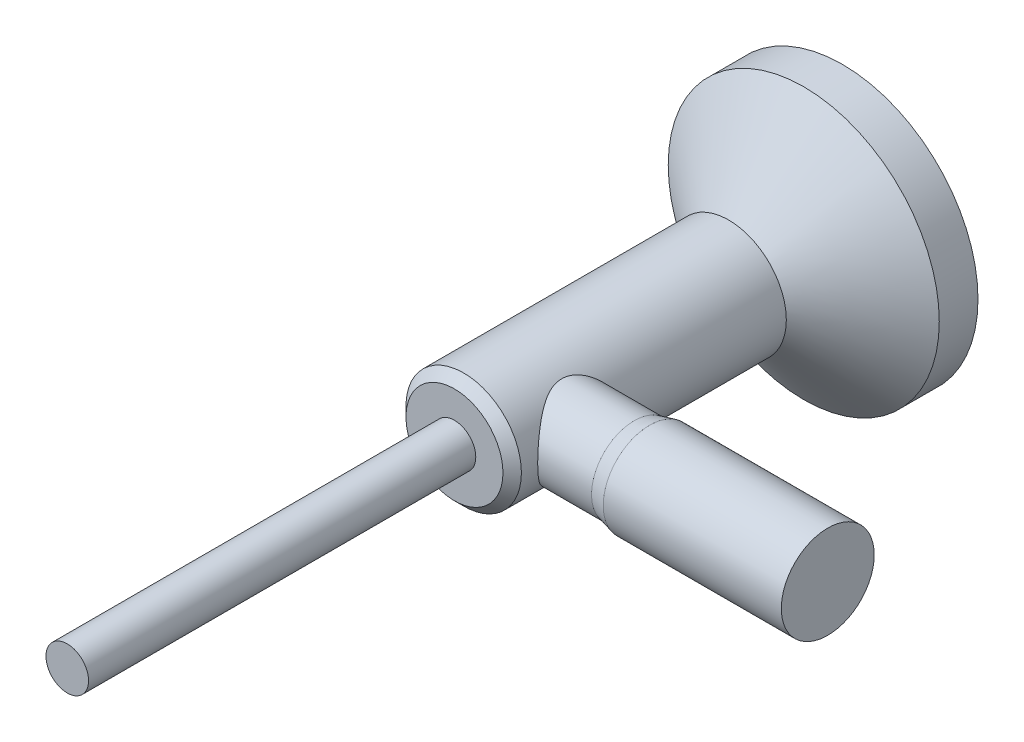
from build123d import *

# Parameters (mm, degrees)
ESQUISSE1_R        = 17.5
BOSS_EXTRU_1_DEPTH = 5
ESQUISSE2_R        = 17.5
BOSS_EXTRU_2_DEPTH = 9.7
CHANFREIN1_SIZE    = 9.7
CHANFREIN1_SIZE2   = 13.05
ESQUISSE3_R        = 7.45
BOSS_EXTRU_3_DEPTH = 35.4
ESQUISSE4_R        = 2.75
BOSS_EXTRU_4_DEPTH = 50
ESQUISSE5_R        = 5.5
BOSS_EXTRU_5_DEPTH = 14.4
CHANFREIN2_SIZE    = 1.19
ESQUISSE6_R        = 6
BOSS_EXTRU_6_DEPTH = 25
CHANFREIN3_SIZE2   = 0.5
CHANFREIN3_SIZE    = 2


with BuildPart() as part:
    # Esquisse1 → Boss.-Extru.1 (new body)
    with BuildSketch(Plane.XY):
        Circle(ESQUISSE1_R)
    extrude(amount=BOSS_EXTRU_1_DEPTH)

    # Esquisse2 → Boss.-Extru.2 (add)
    with BuildSketch(Plane.XY.offset(5)):
        Circle(ESQUISSE2_R)
    extrude(amount=BOSS_EXTRU_2_DEPTH)

    # Chanfrein1
    chanfrein1_edges = [part.edges().sort_by_distance(p)[0] for p in [
        (-17.5, 0, 14.7),
    ]]
    chanfrein1_side = [part.faces().sort_by_distance(p)[0] for p in [
        (-17.5, 0, 7.35),
    ]]
    chamfer(chanfrein1_edges, length=CHANFREIN1_SIZE, length2=CHANFREIN1_SIZE2, reference=chanfrein1_side[0])

    # Esquisse3 → Boss.-Extru.3 (add)
    with BuildSketch(Plane.XY.offset(14.7)):
        Circle(ESQUISSE3_R)
    extrude(amount=BOSS_EXTRU_3_DEPTH)

    # Esquisse4 → Boss.-Extru.4 (add)
    with BuildSketch(Plane.XY.offset(50.1)):
        Circle(ESQUISSE4_R)
    extrude(amount=BOSS_EXTRU_4_DEPTH)

    # Esquisse5 → Boss.-Extru.5 (add)
    with BuildSketch(Plane(origin=(0, 0, 0), x_dir=(0, 0, -1), z_dir=(1, 0, 0))):
        with Locations((-41.3, 0)):
            Circle(ESQUISSE5_R)
    extrude(amount=BOSS_EXTRU_5_DEPTH)

    # Chanfrein2
    chanfrein2_edges = [part.edges().sort_by_distance(p)[0] for p in [
        (-7.45, 0, 50.1),
    ]]
    chamfer(chanfrein2_edges, length=CHANFREIN2_SIZE)

    # Esquisse6 → Boss.-Extru.6 (add)
    with BuildSketch(Plane(origin=(14.4, 0, 0), x_dir=(0, 0, -1), z_dir=(1, 0, 0))):
        with Locations((-41.3, 0)):
            Circle(ESQUISSE6_R)
    extrude(amount=BOSS_EXTRU_6_DEPTH)

    # Chanfrein3
    chanfrein3_edges = [part.edges().sort_by_distance(p)[0] for p in [
        (14.4, 0, 47.3),
    ]]
    chanfrein3_side = [part.faces().sort_by_distance(p)[0] for p in [
        (14.41, 0, 47.3),
    ]]
    chamfer(chanfrein3_edges, length=CHANFREIN3_SIZE - 0.0001, length2=CHANFREIN3_SIZE2 - 0.0001, reference=chanfrein3_side[0])  # a hair under: the kernel refuses the full size


solid = part.part
